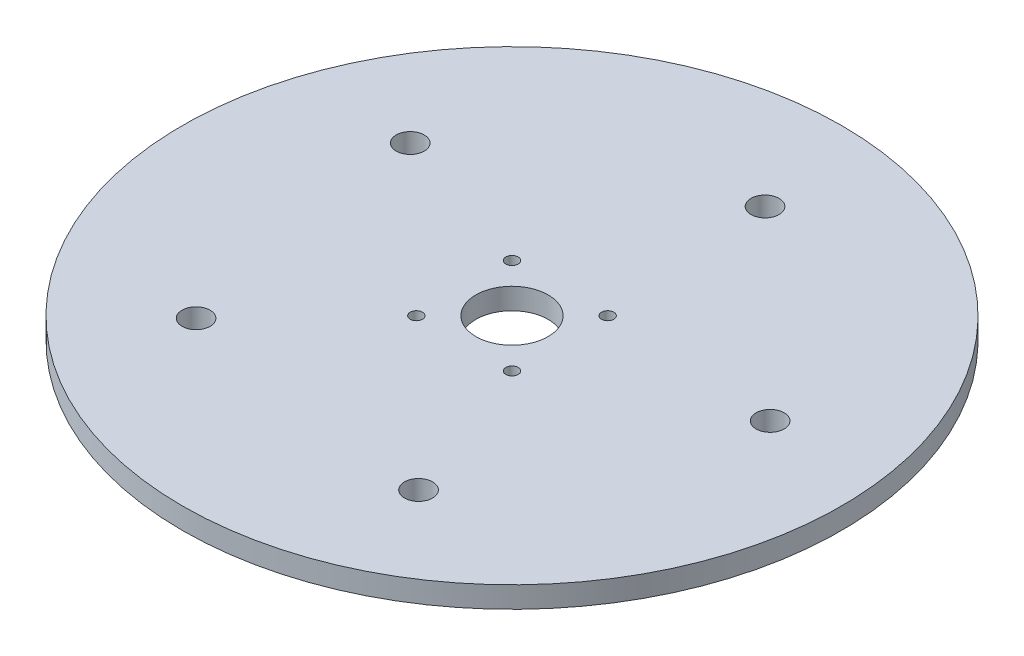
from build123d import *

# Parameters (mm, degrees)
SKETCH1_R              = 77.5
SKETCH1_R_2            = 8.5
BODY_DEPTH             = 5
M6_CLEARANCE_HOLE1_D   = 6.6
M2_5_CLEARANCE_HOLE1_D = 2.9


with BuildPart() as part:
    # Sketch1 → Body (new body)
    with BuildSketch(Plane(origin=(0, 0, 0), x_dir=(1, 0, 0), z_dir=(0, 1, 0))):
        Circle(SKETCH1_R)
        Circle(SKETCH1_R_2, mode=Mode.SUBTRACT)
    extrude(amount=BODY_DEPTH)

    # M6 Clearance Hole1 (through all)
    with Locations(Plane(origin=(0, 5, 0), x_dir=(1, 0, 0), z_dir=(0, 1, 0))):
        with Locations((7.5, 52), (51.772566305, 8.935959835), (24.497205661, -46.4772731), (-36.632460577, -37.660494315), (-47.13731139, 23.20180758), (0, 0)):
            Hole(M6_CLEARANCE_HOLE1_D / 2)

    # M2.5 Clearance Hole1 (through all)
    with Locations(Plane(origin=(0, 5, 0), x_dir=(1, 0, 0), z_dir=(0, 1, 0))):
        with Locations((0, 0), (-11.25, 11.25), (11.25, -11.25), (11.25, 11.25), (-11.25, -11.25)):
            Hole(M2_5_CLEARANCE_HOLE1_D / 2)


solid = part.part
